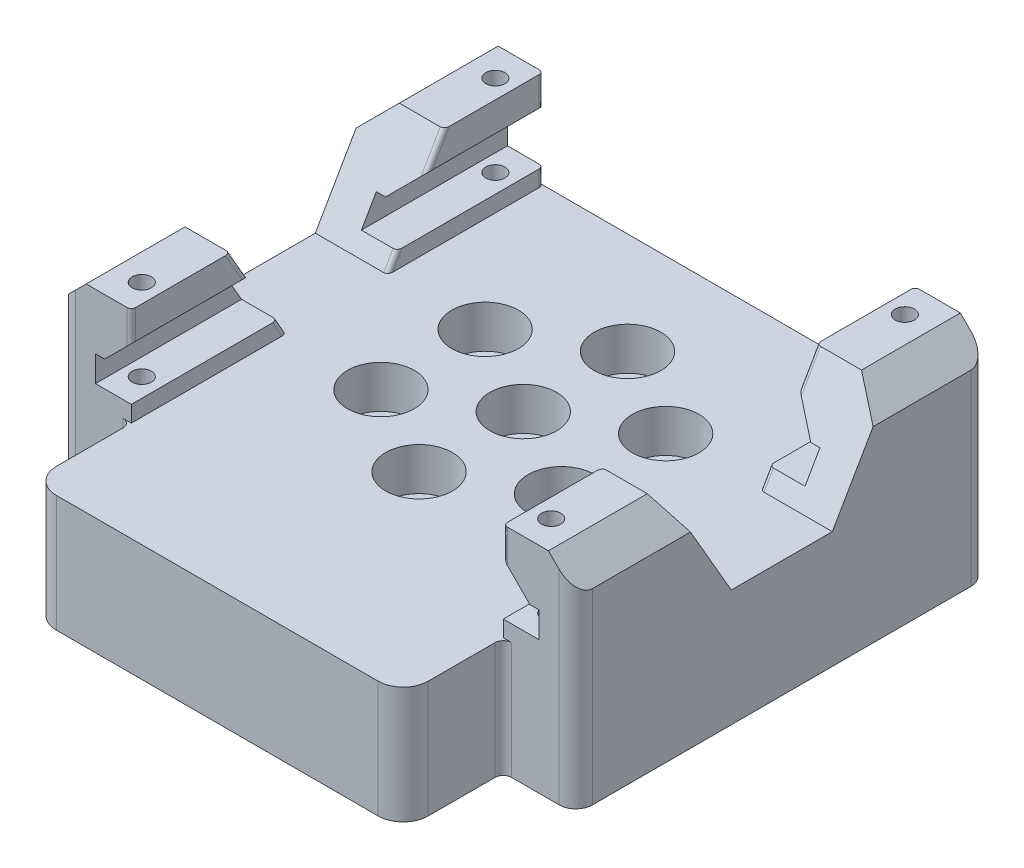
from build123d import *

# Parameters (mm, degrees)
BOSS_EXTRUDE1_DEPTH      = 46.39999966
CUT_EXTRUDE1_REACH       = 58.706
SKETCH2_R                = 1.15
CUT_EXTRUDE2_DEPTH       = 57.705599534
SKETCH4_W                = 80
SKETCH4_H                = 80
BOSS_EXTRUDE2_DEPTH      = 4
CUT_EXTRUDE3_DEPTH       = 96.167247667
MOVE_START               = -46.89999966
MOVE_FACE1_DEPTH         = 0.5
MOVE_FACE1_2_DEPTH       = 0.5
MOVE_START_2             = -31
MOVE_FACE5_DEPTH         = 5
MOVE_START_3             = 26
MOVE_FACE5_2_DEPTH       = 5
MOVE_START_4             = -26
MOVE_FACE5_3_OUTLINE_W   = 6.7001
MOVE_FACE5_3_OUTLINE_H   = 1
MOVE_FACE5_3_OUTLINE_W_2 = 3.95
MOVE_FACE5_3_DEPTH       = 3.7
MOVE_START_5             = 22.3
MOVE_FACE5_4_OUTLINE_W   = 6.7001
MOVE_FACE5_4_OUTLINE_H   = 1
MOVE_FACE5_4_OUTLINE_W_2 = 3.95
MOVE_FACE5_4_DEPTH       = 3.7
MOVE_START_6             = -22.3
MOVE_FACE5_5_OUTLINE_W   = 6.7001
MOVE_FACE5_5_OUTLINE_H   = 1
MOVE_FACE5_5_DEPTH       = 0.0001
MOVE_START_7             = 22.2999
MOVE_FACE5_6_OUTLINE_W   = 6.7001
MOVE_FACE5_6_OUTLINE_H   = 1
MOVE_FACE5_6_DEPTH       = 0.0001
MOVE_START_8             = -47.89999966
MOVE_FACE5_7_DEPTH       = 49.39999966
FILLET2_R                = 2
FILLET3_R                = 0.5
MOVE_FACE2_BY            = 0.5
MOVE_FACE2_2_BY          = 0.5
MOVE_FACE2_3_BY          = 0.5
MOVE_FACE2_4_BY          = 0.5
MOVE_START_9             = 2.95
MOVE_FACE3_OUTLINE_R     = 1.15
MOVE_FACE3_DEPTH         = 2
MOVE_FACE4_BY            = 2
MOVE_FACE6_BY            = 5
MOVE_FACE6_2_BY          = 5
MOVE_FACE6_3_BY          = 5
MOVE_FACE6_4_BY          = 5
MOVE_FACE13_BY           = 0.1
MOVE_FACE13_2_BY         = 0.1
MOVE_FACE13_3_BY         = 0.1
MOVE_FACE13_4_BY         = 0.1
SKETCH19_R               = 2.25
CUT_EXTRUDE11_DEPTH      = 77.872010696
SKETCH20_R               = 4
CUT_EXTRUDE12_DEPTH      = 4.1
SKETCH21_W               = 80
SKETCH21_H               = 80
CUT_EXTRUDE13_DEPTH      = 76.711986029
MOVE_FACE14_BY           = 1
MOVE_FACE14_2_BY         = 1
MOVE_FACE14_3_BY         = 1
MOVE_FACE14_4_BY         = 1
MOVE_FACE14_5_BY         = 1
MOVE_FACE14_6_BY         = 1
MOVE_FACE14_7_BY         = 1
DELETEFACE2_DEPTH        = 2.95
SKETCH23_W               = 44.6
SKETCH23_H               = 6
BOSS_EXTRUDE6_DEPTH      = 12
FILLET7_R                = 1
FILLET8_R                = 3
MOVE_FACE15_BY           = 8


with BuildPart() as part:
    # Sketch1 → Boss-Extrude1 (new body)
    with BuildSketch(Plane.XY):
        Polygon((0, 0), (30, 0), (30, 12.7501), (22.2999, 12.7501), (22.2999, 9.7501), (22.2999, 9.2501), (25.5, 6.05), (26, 6.05), (26, 4.95), (22.3, 4.95), (22.3, 1), (0, 1), align=None)
    extrude(amount=-BOSS_EXTRUDE1_DEPTH)

    # Mirror1: part across plane


with BuildPart() as part_1:
    add(part.part)
    add(part.part.mirror(Plane(origin=(0, 1, -46.39999966), x_dir=(0, 0, 1), z_dir=(-1, 0, 0))))

    # Cut-Extrude1: up to this face of the body (flat: up to its plane)
    cut_extrude1_end = Plane(part_1.part.faces().sort_by_distance((0, 1, -23.19999983))[0])
    # Sketch2 → Cut-Extrude1 (cut, up to the picked face)
    with BuildSketch(Plane(origin=(0, 12.7501, 0), x_dir=(1, 0, 0), z_dir=(0, 1, 0)), mode=Mode.PRIVATE) as cut_extrude1_sk1:
        with Locations(Location((-24.549999831, 44.399999661, 0), (0, 0, 270))):
            Circle(SKETCH2_R)
    cut_extrude1_tool1 = split(extrude(cut_extrude1_sk1.sketch, amount=-CUT_EXTRUDE1_REACH, mode=Mode.PRIVATE), bisect_by=cut_extrude1_end, keep=Keep.BOTH, mode=Mode.PRIVATE)
    # Sketch2 → Cut-Extrude1 (cut, up to the picked face)
    with BuildSketch(Plane(origin=(0, 12.7501, 0), x_dir=(1, 0, 0), z_dir=(0, 1, 0)), mode=Mode.PRIVATE) as cut_extrude1_sk2:
        with Locations(Location((-24.549999831, 1.999999999, 0), (0, 0, 270))):
            Circle(SKETCH2_R)
    cut_extrude1_tool2 = split(extrude(cut_extrude1_sk2.sketch, amount=-CUT_EXTRUDE1_REACH, mode=Mode.PRIVATE), bisect_by=cut_extrude1_end, keep=Keep.BOTH, mode=Mode.PRIVATE)
    # Sketch2 → Cut-Extrude1 (cut, up to the picked face)
    with BuildSketch(Plane(origin=(0, 12.7501, 0), x_dir=(1, 0, 0), z_dir=(0, 1, 0)), mode=Mode.PRIVATE) as cut_extrude1_sk3:
        with Locations(Location((24.549999831, 1.999999999, 0), (0, 0, 270))):
            Circle(SKETCH2_R)
    cut_extrude1_tool3 = split(extrude(cut_extrude1_sk3.sketch, amount=-CUT_EXTRUDE1_REACH, mode=Mode.PRIVATE), bisect_by=cut_extrude1_end, keep=Keep.BOTH, mode=Mode.PRIVATE)
    # Sketch2 → Cut-Extrude1 (cut, up to the picked face)
    with BuildSketch(Plane(origin=(0, 12.7501, 0), x_dir=(1, 0, 0), z_dir=(0, 1, 0)), mode=Mode.PRIVATE) as cut_extrude1_sk4:
        with Locations(Location((24.549999831, 44.399999661, 0), (0, 0, 270))):
            Circle(SKETCH2_R)
    cut_extrude1_tool4 = split(extrude(cut_extrude1_sk4.sketch, amount=-CUT_EXTRUDE1_REACH, mode=Mode.PRIVATE), bisect_by=cut_extrude1_end, keep=Keep.BOTH, mode=Mode.PRIVATE)
    add(cut_extrude1_tool1.solids().sort_by(Axis((-24.55, 12.7501, -44.4), (0, -1, 0)))[0], mode=Mode.SUBTRACT)
    add(cut_extrude1_tool2.solids().sort_by(Axis((-24.55, 12.7501, -2), (0, -1, 0)))[0], mode=Mode.SUBTRACT)
    add(cut_extrude1_tool3.solids().sort_by(Axis((24.55, 12.7501, -2), (0, -1, 0)))[0], mode=Mode.SUBTRACT)
    add(cut_extrude1_tool4.solids().sort_by(Axis((24.55, 12.7501, -44.4), (0, -1, 0)))[0], mode=Mode.SUBTRACT)

    # Sketch3 → Cut-Extrude2 (cut, through all)
    with BuildSketch(Plane.XY):
        Polygon((26.3, 12.7501), (30, 9.0501), (30, 12.7501), align=None)
        Polygon((-30, 12.7501), (-30, 9.0501), (-26.3, 12.7501), align=None)
    extrude(amount=-CUT_EXTRUDE2_DEPTH, mode=Mode.SUBTRACT)

    # Sketch4 → Boss-Extrude2 (add)
    with BuildSketch(Plane.XZ.offset(-1)):
        with Locations((0, -23.19999983)):
            Rectangle(SKETCH4_W, SKETCH4_H)
    extrude(amount=BOSS_EXTRUDE2_DEPTH)

    # Sketch5 → Cut-Extrude3 (cut, through all)
    with BuildSketch(Plane.ZY.offset(30)):
        Polygon((-37.19999983, 12.7501), (-30.416076432, 1), (-15.983923228, 1), (-9.19999983, 12.7501), align=None)
    extrude(amount=-CUT_EXTRUDE3_DEPTH, mode=Mode.SUBTRACT)

    # Move Face1: read off the stored shape, not the designer's step
    # Move Face1 outline → Move Face1 (add)
    with BuildSketch(Plane.XY.offset(MOVE_START)):
        Polygon((22.3, 1), (30, 1), (30, 9.0501), (26.3, 12.7501), (22.2999, 12.7501), (22.2999, 9.2501), (25.5, 6.05), (26, 6.05), (26, 4.95), (22.3, 4.95), align=None)
        Polygon((-30, 1), (-22.3, 1), (-22.3, 4.95), (-26, 4.95), (-26, 6.05), (-25.5, 6.05), (-22.2999, 9.2501), (-22.2999, 12.7501), (-26.3, 12.7501), (-30, 9.0501), align=None)
    extrude(amount=MOVE_FACE1_DEPTH)

    # Move Face1 2 outline → Move Face1 2 (add)
    with BuildSketch(Plane.XY):
        Polygon((22.3, 1), (30, 1), (30, 9.0501), (26.3, 12.7501), (22.2999, 12.7501), (22.2999, 9.2501), (25.5, 6.05), (26, 6.05), (26, 4.95), (22.3, 4.95), align=None)
        Polygon((-30, 1), (-22.3, 1), (-22.3, 4.95), (-26, 4.95), (-26, 6.05), (-25.5, 6.05), (-22.2999, 9.2501), (-22.2999, 12.7501), (-26.3, 12.7501), (-30, 9.0501), align=None)
    extrude(amount=MOVE_FACE1_2_DEPTH)

    # Move Face5: read off the stored shape, not the designer's step
    # Move Face5 outline → Move Face5 (add)
    with BuildSketch(Plane.YZ.offset(MOVE_START_2)):
        Polygon((12.7501, -10.354700368), (12.7501, 1.5), (1, 1.5), (1, -17.138623766), align=None)
        Polygon((1, -29.261375894), (1, -47.89999966), (12.7501, -47.89999966), (12.7501, -36.045299292), align=None)
    extrude(amount=MOVE_FACE5_DEPTH)

    # Move Face5 2 outline → Move Face5 2 (add)
    with BuildSketch(Plane.YZ.offset(MOVE_START_3)):
        Polygon((12.7501, -10.354700368), (12.7501, 1.5), (1, 1.5), (1, -17.138623766), align=None)
        Polygon((1, -29.261375894), (1, -47.89999966), (12.7501, -47.89999966), (12.7501, -36.045299292), align=None)
    extrude(amount=MOVE_FACE5_2_DEPTH)

    # Move Face5 3 outline → Move Face5 3 (add)
    with BuildSketch(Plane.YZ.offset(MOVE_START_4)):
        Polygon((6.05, -14.223004907), (12.7501, -10.354700368), (12.7501, -9.19999983), (6.05, -13.068304369), align=None)
        Polygon((4.95, -31.541909457), (1, -29.261375894), (1, -30.416076432), (4.95, -32.696609995), align=None)
        with Locations((9.40005, 1)):
            Rectangle(MOVE_FACE5_3_OUTLINE_W, MOVE_FACE5_3_OUTLINE_H)
        Polygon((1, -17.138623766), (4.95, -14.858090203), (4.95, -13.703389665), (1, -15.983923228), align=None)
        with Locations((2.975, 1)):
            Rectangle(MOVE_FACE5_3_OUTLINE_W_2, MOVE_FACE5_3_OUTLINE_H)
        Polygon((12.7501, -36.045299292), (6.05, -32.176994753), (6.05, -33.331695291), (12.7501, -37.19999983), align=None)
        with Locations((2.975, -47.39999966)):
            Rectangle(MOVE_FACE5_3_OUTLINE_W_2, MOVE_FACE5_3_OUTLINE_H)
        with Locations((9.40005, -47.39999966)):
            Rectangle(MOVE_FACE5_3_OUTLINE_W, MOVE_FACE5_3_OUTLINE_H)
    extrude(amount=MOVE_FACE5_3_DEPTH)

    # Move Face5 4 outline → Move Face5 4 (add)
    with BuildSketch(Plane.YZ.offset(MOVE_START_5)):
        Polygon((6.05, -14.223004907), (12.7501, -10.354700368), (12.7501, -9.19999983), (6.05, -13.068304369), align=None)
        Polygon((4.95, -31.541909457), (1, -29.261375894), (1, -30.416076432), (4.95, -32.696609995), align=None)
        with Locations((9.40005, 1)):
            Rectangle(MOVE_FACE5_4_OUTLINE_W, MOVE_FACE5_4_OUTLINE_H)
        Polygon((1, -17.138623766), (4.95, -14.858090203), (4.95, -13.703389665), (1, -15.983923228), align=None)
        with Locations((2.975, 1)):
            Rectangle(MOVE_FACE5_4_OUTLINE_W_2, MOVE_FACE5_4_OUTLINE_H)
        Polygon((12.7501, -36.045299292), (6.05, -32.176994753), (6.05, -33.331695291), (12.7501, -37.19999983), align=None)
        with Locations((2.975, -47.39999966)):
            Rectangle(MOVE_FACE5_4_OUTLINE_W_2, MOVE_FACE5_4_OUTLINE_H)
        with Locations((9.40005, -47.39999966)):
            Rectangle(MOVE_FACE5_4_OUTLINE_W, MOVE_FACE5_4_OUTLINE_H)
    extrude(amount=MOVE_FACE5_4_DEPTH)

    # Move Face5 5 outline → Move Face5 5 (add)
    with BuildSketch(Plane.YZ.offset(MOVE_START_6)):
        Polygon((6.05, -14.223004907), (12.7501, -10.354700368), (12.7501, -9.19999983), (6.05, -13.068304369), align=None)
        with Locations((9.40005, 1)):
            Rectangle(MOVE_FACE5_5_OUTLINE_W, MOVE_FACE5_5_OUTLINE_H)
        Polygon((12.7501, -36.045299292), (6.05, -32.176994753), (6.05, -33.331695291), (12.7501, -37.19999983), align=None)
        with Locations((9.40005, -47.39999966)):
            Rectangle(MOVE_FACE5_5_OUTLINE_W, MOVE_FACE5_5_OUTLINE_H)
    extrude(amount=MOVE_FACE5_5_DEPTH)

    # Move Face5 6 outline → Move Face5 6 (add)
    with BuildSketch(Plane.YZ.offset(MOVE_START_7)):
        Polygon((6.05, -14.223004907), (12.7501, -10.354700368), (12.7501, -9.19999983), (6.05, -13.068304369), align=None)
        with Locations((9.40005, 1)):
            Rectangle(MOVE_FACE5_6_OUTLINE_W, MOVE_FACE5_6_OUTLINE_H)
        Polygon((12.7501, -36.045299292), (6.05, -32.176994753), (6.05, -33.331695291), (12.7501, -37.19999983), align=None)
        with Locations((9.40005, -47.39999966)):
            Rectangle(MOVE_FACE5_6_OUTLINE_W, MOVE_FACE5_6_OUTLINE_H)
    extrude(amount=MOVE_FACE5_6_DEPTH)

    # Move Face5 7 outline → Move Face5 7 (cut)
    with BuildSketch(Plane.XY.offset(MOVE_START_8)):
        Polygon((31, 12.7501), (27.714213562, 12.7501), (31, 9.464313562), align=None)
        Polygon((25.5, 6.05), (22.2999, 9.2501), (22.2999, 6.05), align=None)
        Polygon((-31, 9.464313562), (-27.714213562, 12.7501), (-31, 12.7501), align=None)
        Polygon((-22.2999, 9.2501), (-25.5, 6.05), (-22.2999, 6.05), align=None)
    extrude(amount=MOVE_FACE5_7_DEPTH, mode=Mode.SUBTRACT)

    # Fillet2
    fillet2_edges = [part_1.edges().sort_by_distance(p)[0] for p in [
        (-31, 5.232156781, -47.89999966),
        (-31, 5.232156781, 1.5),
        (31, 5.232156781, 1.5),
        (31, 5.232156781, -47.89999966),
    ]]
    fillet(fillet2_edges, radius=FILLET2_R)

    # Fillet3
    fillet3_edges = [part_1.edges().sort_by_distance(p)[0] for p in [
        (22.3, 2.975, 1.5),
        (22.2999, 11.0001, 1.5),
        (22.3, 2.975, -15.998356984),
        (22.2999, 11.0001, -11.365063339),
        (-22.2999, 11.0001, -11.365063339),
        (-22.3, 2.975, -15.998356984),
        (22.3, 2.975, -30.401642675),
        (-22.3, 2.975, -30.401642675),
        (-22.2999, 11.0001, -35.034936321),
        (22.2999, 11.0001, -35.034936321),
        (22.2999, 11.0001, -47.89999966),
        (-22.3, 2.975, 1.5),
        (-22.2999, 11.0001, 1.5),
        (-22.2999, 11.0001, -47.89999966),
        (-22.3, 2.975, -47.89999966),
        (22.3, 2.975, -47.89999966),
    ]]
    fillet(fillet3_edges, radius=FILLET3_R)

    # Move Face2: a face moved inward by 0.5
    extrude(part_1.faces().sort_by_distance((26, 5.496370688, -6.52132147))[0], amount=MOVE_FACE2_BY, dir=(1, 0, 0), mode=Mode.SUBTRACT)

    # Move Face2 2: a face moved inward by 0.5
    extrude(part_1.faces().sort_by_distance((26, 5.496370688, -39.87867819))[0], amount=MOVE_FACE2_2_BY, dir=(1, 0, 0), mode=Mode.SUBTRACT)

    # Move Face2 3: a face moved inward by 0.5
    extrude(part_1.faces().sort_by_distance((-26, 5.496370688, -39.87867819))[0], amount=MOVE_FACE2_3_BY, dir=(-1, 0, 0), mode=Mode.SUBTRACT)

    # Move Face2 4: a face moved inward by 0.5
    extrude(part_1.faces().sort_by_distance((-26, 5.496370688, -6.52132147))[0], amount=MOVE_FACE2_4_BY, dir=(-1, 0, 0), mode=Mode.SUBTRACT)

    # Move Face3: read off the stored shape, not the designer's step
    # Move Face3 outline → Move Face3 (cut)
    # profile 1 of 2: a face of its own
    with BuildSketch(Plane(origin=(0, 0, 0), x_dir=(1, 0, 0), z_dir=(0, 1, 0)).offset(MOVE_START_9)):
        with BuildLine():
            Line((26.5, -1.5), (26.5, 47.89999966))
            Line((26.5, 47.89999966), (22.8, 47.89999966))
            ThreePointArc((22.8, 47.89999966), (22.446446609, 47.753553051), (22.3, 47.39999966))
            Line((22.3, 47.39999966), (22.3, -1))
            ThreePointArc((22.3, -1), (22.446446609, -1.353553391), (22.8, -1.5))
            Line((22.8, -1.5), (26.5, -1.5))
        make_face()
        with Locations((24.549999831, 1.999999999)):
            Circle(MOVE_FACE3_OUTLINE_R, mode=Mode.SUBTRACT)
        with Locations((24.549999831, 44.399999661)):
            Circle(MOVE_FACE3_OUTLINE_R, mode=Mode.SUBTRACT)
    # profile 2 of 2: a face of its own
    with BuildSketch(Plane(origin=(0, 0, 0), x_dir=(1, 0, 0), z_dir=(0, 1, 0)).offset(MOVE_START_9)):
        with BuildLine():
            ThreePointArc((-22.8, -1.5), (-22.446446609, -1.353553391), (-22.3, -1))
            Line((-22.3, -1), (-22.3, 47.39999966))
            ThreePointArc((-22.3, 47.39999966), (-22.446446609, 47.753553051), (-22.8, 47.89999966))
            Line((-22.8, 47.89999966), (-26.5, 47.89999966))
            Line((-26.5, 47.89999966), (-26.5, -1.5))
            Line((-26.5, -1.5), (-22.8, -1.5))
        make_face()
        with Locations((-24.549999831, 1.999999999)):
            Circle(MOVE_FACE3_OUTLINE_R, mode=Mode.SUBTRACT)
        with Locations((-24.549999831, 44.399999661)):
            Circle(MOVE_FACE3_OUTLINE_R, mode=Mode.SUBTRACT)
    extrude(amount=MOVE_FACE3_DEPTH, mode=Mode.SUBTRACT)

    # Move Face4: a face moved outward by 2.0
    extrude(part_1.faces().sort_by_distance((0, -3, -23.19999983))[0], amount=MOVE_FACE4_BY, dir=(0, -1, 0))

    # Move Face6: a face moved inward by 5.0
    extrude(part_1.faces().sort_by_distance((24.549999831, 1, -1.999999999))[0], amount=MOVE_FACE6_BY, dir=(0, -1, 0), mode=Mode.SUBTRACT)

    # Move Face6 2: a face moved inward by 5.0
    extrude(part_1.faces().sort_by_distance((24.549999831, 1, -44.399999661))[0], amount=MOVE_FACE6_2_BY, dir=(0, -1, 0), mode=Mode.SUBTRACT)

    # Move Face6 3: a face moved inward by 5.0
    extrude(part_1.faces().sort_by_distance((-24.549999831, 1, -44.399999661))[0], amount=MOVE_FACE6_3_BY, dir=(0, -1, 0), mode=Mode.SUBTRACT)

    # Move Face6 4: a face moved inward by 5.0
    extrude(part_1.faces().sort_by_distance((-24.549999831, 1, -1.999999999))[0], amount=MOVE_FACE6_4_BY, dir=(0, -1, 0), mode=Mode.SUBTRACT)

    # Move Face13: a face moved inward by 0.1
    extrude(part_1.faces().sort_by_distance((26.5, 4.472176906, -6.816980748))[0], amount=MOVE_FACE13_BY, dir=(1, 0, 0), mode=Mode.SUBTRACT)

    # Move Face13 2: a face moved inward by 0.1
    extrude(part_1.faces().sort_by_distance((26.5, 4.472176906, -39.583018912))[0], amount=MOVE_FACE13_2_BY, dir=(1, 0, 0), mode=Mode.SUBTRACT)

    # Move Face13 3: a face moved inward by 0.1
    extrude(part_1.faces().sort_by_distance((-26.5, 4.472176906, -39.583018912))[0], amount=MOVE_FACE13_3_BY, dir=(-1, 0, 0), mode=Mode.SUBTRACT)

    # Move Face13 4: a face moved inward by 0.1
    extrude(part_1.faces().sort_by_distance((-26.5, 4.472176906, -6.816980748))[0], amount=MOVE_FACE13_4_BY, dir=(-1, 0, 0), mode=Mode.SUBTRACT)

    # Sketch19 → Cut-Extrude11 (cut, through all)
    with BuildSketch(Plane.XZ.offset(5)):
        with Locations(Location((0, -23.19999983, 0), (0, 0, 270))):
            Circle(SKETCH19_R)
        with Locations(Location((0, -10.69999983, 0), (0, 0, 270))):
            Circle(SKETCH19_R)
        with Locations(Location((0, -35.69999983, 0), (0, 0, 270))):
            Circle(SKETCH19_R)
        with Locations(Location((10.825317547, -29.44999983, 0), (0, 0, 270))):
            Circle(SKETCH19_R)
        with Locations(Location((10.825317547, -16.94999983, 0), (0, 0, 270))):
            Circle(SKETCH19_R)
        with Locations(Location((-10.825317547, -16.94999983, 0), (0, 0, 270))):
            Circle(SKETCH19_R)
        with Locations(Location((-10.825317547, -29.44999983, 0), (0, 0, 270))):
            Circle(SKETCH19_R)
    extrude(amount=-CUT_EXTRUDE11_DEPTH, mode=Mode.SUBTRACT)

    # Sketch20 → Cut-Extrude12 (cut)
    with BuildSketch(Plane(origin=(0, 1, 0), x_dir=(1, 0, 0), z_dir=(0, 1, 0))):
        with Locations(Location((-10.825317547, 29.44999983, 0), (0, 0, 270))):
            Circle(SKETCH20_R)
        with Locations(Location((0, 23.19999983, 0), (0, 0, 270))):
            Circle(SKETCH20_R)
        with Locations(Location((0, 35.69999983, 0), (0, 0, 270))):
            Circle(SKETCH20_R)
        with Locations(Location((10.825317547, 29.44999983, 0), (0, 0, 270))):
            Circle(SKETCH20_R)
        with Locations(Location((10.825317547, 16.94999983, 0), (0, 0, 270))):
            Circle(SKETCH20_R)
        with Locations(Location((0, 10.69999983, 0), (0, 0, 270))):
            Circle(SKETCH20_R)
        with Locations(Location((-10.825317547, 16.94999983, 0), (0, 0, 270))):
            Circle(SKETCH20_R)
    extrude(amount=-CUT_EXTRUDE12_DEPTH, mode=Mode.SUBTRACT)

    # Sketch21 → Cut-Extrude13 (cut, through all)
    with BuildSketch(Plane(origin=(0, 1, 0), x_dir=(1, 0, 0), z_dir=(0, 1, 0))):
        with Locations((0, 23.19999983)):
            Rectangle(SKETCH21_W, SKETCH21_H)
        with BuildLine():
            Line((-31, 45.89999966), (-31, 0.5))
            ThreePointArc((-31, 0.5), (-30.414213562, -0.914213562), (-29, -1.5))
            Line((-29, -1.5), (29, -1.5))
            ThreePointArc((29, -1.5), (30.414213562, -0.914213562), (31, 0.5))
            Line((31, 0.5), (31, 45.89999966))
            ThreePointArc((31, 45.89999966), (30.414213562, 47.314213222), (29, 47.89999966))
            Line((29, 47.89999966), (-29, 47.89999966))
            ThreePointArc((-29, 47.89999966), (-30.414213562, 47.314213222), (-31, 45.89999966))
        make_face(mode=Mode.SUBTRACT)
    extrude(amount=-CUT_EXTRUDE13_DEPTH, mode=Mode.SUBTRACT)

    # Move Face14: a face moved inward by 1.0
    extrude(part_1.faces().sort_by_distance((0, -3.1, -32.49999983))[0], amount=MOVE_FACE14_BY, dir=(0, -1, 0), mode=Mode.SUBTRACT)

    # Move Face14 2: a face moved inward by 1.0
    extrude(part_1.faces().sort_by_distance((10.825317547, -3.1, -26.24999983))[0], amount=MOVE_FACE14_2_BY, dir=(0, -1, 0), mode=Mode.SUBTRACT)

    # Move Face14 3: a face moved inward by 1.0
    extrude(part_1.faces().sort_by_distance((0, -3.1, -19.99999983))[0], amount=MOVE_FACE14_3_BY, dir=(0, -1, 0), mode=Mode.SUBTRACT)

    # Move Face14 4: a face moved inward by 1.0
    extrude(part_1.faces().sort_by_distance((-10.825317547, -3.1, -26.24999983))[0], amount=MOVE_FACE14_4_BY, dir=(0, -1, 0), mode=Mode.SUBTRACT)

    # Move Face14 5: a face moved inward by 1.0
    extrude(part_1.faces().sort_by_distance((-10.825317547, -3.1, -13.74999983))[0], amount=MOVE_FACE14_5_BY, dir=(0, -1, 0), mode=Mode.SUBTRACT)

    # Move Face14 6: a face moved inward by 1.0
    extrude(part_1.faces().sort_by_distance((0, -3.1, -7.49999983))[0], amount=MOVE_FACE14_6_BY, dir=(0, -1, 0), mode=Mode.SUBTRACT)

    # Move Face14 7: a face moved inward by 1.0
    extrude(part_1.faces().sort_by_distance((10.825317547, -3.1, -13.74999983))[0], amount=MOVE_FACE14_7_BY, dir=(0, -1, 0), mode=Mode.SUBTRACT)

    # DeleteFace2: read off the stored shape, not the designer's step
    # DeleteFace2 outline → DeleteFace2 (add)
    with BuildSketch(Plane(origin=(0, 0, 0), x_dir=(1, 0, 0), z_dir=(0, 1, 0))):
        with BuildLine():
            Line((22.3, -1.5), (22.8, -1.5))
            ThreePointArc((22.8, -1.5), (22.446446609, -1.353553391), (22.3, -1))
            Line((22.3, -1), (22.3, -1.5))
        make_face()
        with BuildLine():
            Line((-22.8, -1.5), (-22.3, -1.5))
            Line((-22.3, -1.5), (-22.3, -1))
            ThreePointArc((-22.3, -1), (-22.446446609, -1.353553391), (-22.8, -1.5))
        make_face()
    extrude(amount=DELETEFACE2_DEPTH)

    # Sketch23 → Boss-Extrude6 (add)
    with BuildSketch(Plane.XY.offset(1.5)):
        with Locations((0, -2)):
            Rectangle(SKETCH23_W, SKETCH23_H)
    extrude(amount=BOSS_EXTRUDE6_DEPTH)

    # Fillet7
    fillet7_edges = [part_1.edges().sort_by_distance(p)[0] for p in [
        (-22.3, -2, 1.5),
        (22.3, -2, 1.5),
    ]]
    fillet(fillet7_edges, radius=FILLET7_R)

    # Fillet8
    fillet8_edges = [part_1.edges().sort_by_distance(p)[0] for p in [
        (-22.3, -2, 13.5),
        (22.3, -2, 13.5),
    ]]
    fillet(fillet8_edges, radius=FILLET8_R)

    # Move Face15: a face moved outward by 8.0
    extrude(part_1.faces().sort_by_distance((0, -5, -18.515205364))[0], amount=MOVE_FACE15_BY, dir=(0, -1, 0))


solid = part_1.part
